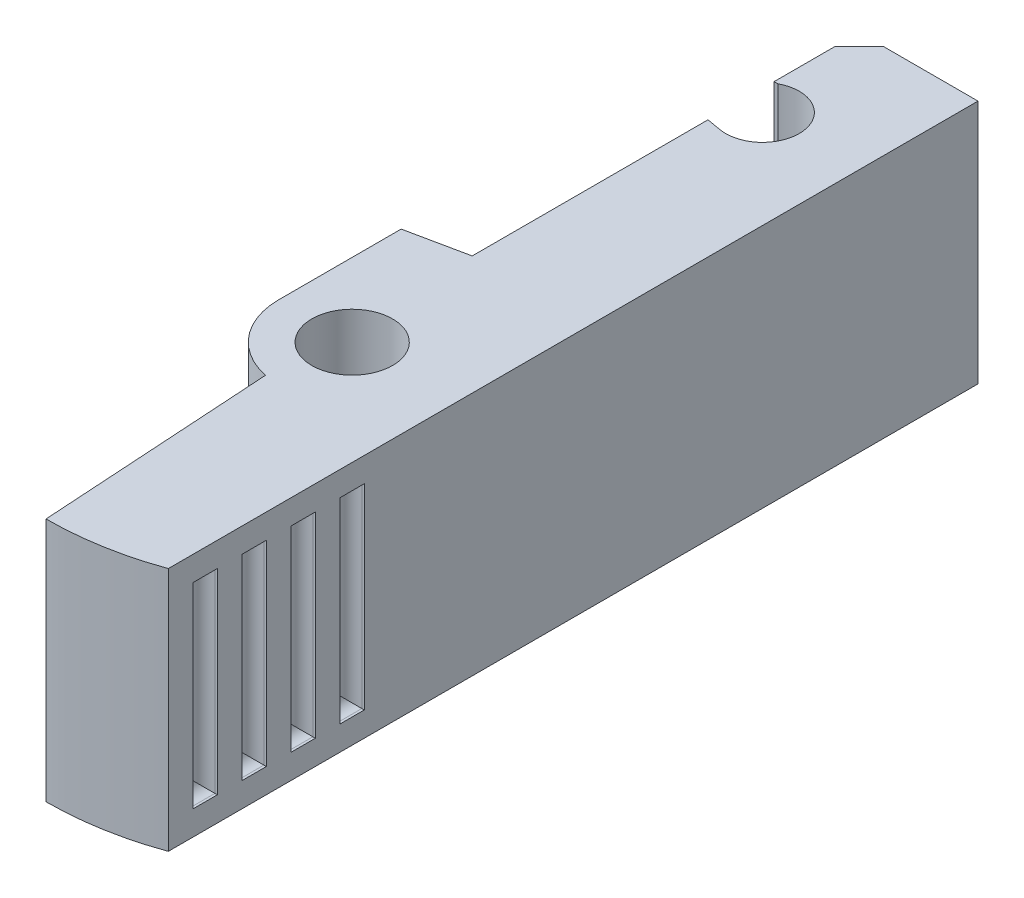
from build123d import *

# Parameters (mm, degrees)
SKETCH1_R           = 1.65
BOSS_EXTRUDE1_DEPTH = 10
CUT_EXTRUDE1_START  = -2
SKETCH2_R           = 2.5
CUT_EXTRUDE1_DEPTH  = 10
SKETCH3_W           = 1
SKETCH3_H           = 8
CUT_EXTRUDE2_DEPTH  = 0.6
FILLET1_R           = 0.5


with BuildPart() as part:
    # Sketch1 → Boss-Extrude1 (new body)
    with BuildSketch(Plane(origin=(0, 0, 0), x_dir=(1, 0, 0), z_dir=(0, 1, 0))):
        with BuildLine():
            Line((4.25, 21.3), (4.25, -11.755317946))
            ThreePointArc((4.25, -11.755317946), (2.157374061, -12.312422067), (0, -12.5))
            Line((0, -12.5), (-0.6, -2.939387691))
            ThreePointArc((-0.6, -2.939387691), (-2.323790008, -1.897366596), (-3, 0))
            Line((-3, 0), (-3, 5))
            Line((-3, 5), (-0.6, 5.5))
            Line((-0.6, 5.5), (-0.6, 15.126776243))
            Line((-0.6, 15.126776243), (0, 15.020980054))
            ThreePointArc((0, 15.020980054), (1.731070844, 16.737548219), (-0.45, 17.826649916))
            Line((-0.45, 17.826649916), (-0.6, 17.826649916))
            Line((-0.6, 17.826649916), (-0.6, 20.3))
            Line((-0.6, 20.3), (0.4, 21.3))
            Line((0.4, 21.3), (4.25, 21.3))
        make_face()
        with Locations(Location((0, 0, 0), (0, 0, 270))):
            Circle(SKETCH1_R, mode=Mode.SUBTRACT)
    extrude(amount=BOSS_EXTRUDE1_DEPTH)

    # Sketch2 → Cut-Extrude1 (cut)
    with BuildSketch(Plane(origin=(4.25, 0, 0), x_dir=(0, 0, -1), z_dir=(1, 0, 0)).offset(CUT_EXTRUDE1_START)):
        with Locations((-7, 5)):
            Circle(SKETCH2_R)
    extrude(amount=-CUT_EXTRUDE1_DEPTH, mode=Mode.SUBTRACT)

    # Sketch3 → Cut-Extrude2 (cut)
    with BuildSketch(Plane(origin=(4.25, 0, 0), x_dir=(0, 0, -1), z_dir=(1, 0, 0))):
        with Locations((-10.255317946, 5)):
            Rectangle(SKETCH3_W, SKETCH3_H)
        with Locations((-8.255317946, 5)):
            Rectangle(SKETCH3_W, SKETCH3_H)
        with Locations((-6.255317946, 5)):
            Rectangle(SKETCH3_W, SKETCH3_H)
        with Locations((-4.255317946, 5)):
            Rectangle(SKETCH3_W, SKETCH3_H)
    extrude(amount=-CUT_EXTRUDE2_DEPTH, mode=Mode.SUBTRACT)

    # Fillet1
    fillet1_edges = [part.edges().sort_by_distance(p)[0] for p in [
        (3.65, 5, 10.755317946),
        (3.65, 9, 10.255317946),
        (3.65, 5, 9.755317946),
        (3.65, 1, 10.255317946),
        (3.65, 5, 8.755317946),
        (3.65, 9, 8.255317946),
        (3.65, 5, 7.755317946),
        (3.65, 1, 8.255317946),
        (3.65, 5, 6.755317946),
        (3.65, 9, 6.255317946),
        (3.65, 5, 5.755317946),
        (3.65, 1, 6.255317946),
        (3.65, 5, 4.755317946),
        (3.65, 9, 4.255317946),
        (3.65, 5, 3.755317946),
        (3.65, 1, 4.255317946),
    ]]
    fillet(fillet1_edges, radius=FILLET1_R - 0.0001)  # a hair under: the kernel refuses the full size


solid = part.part
